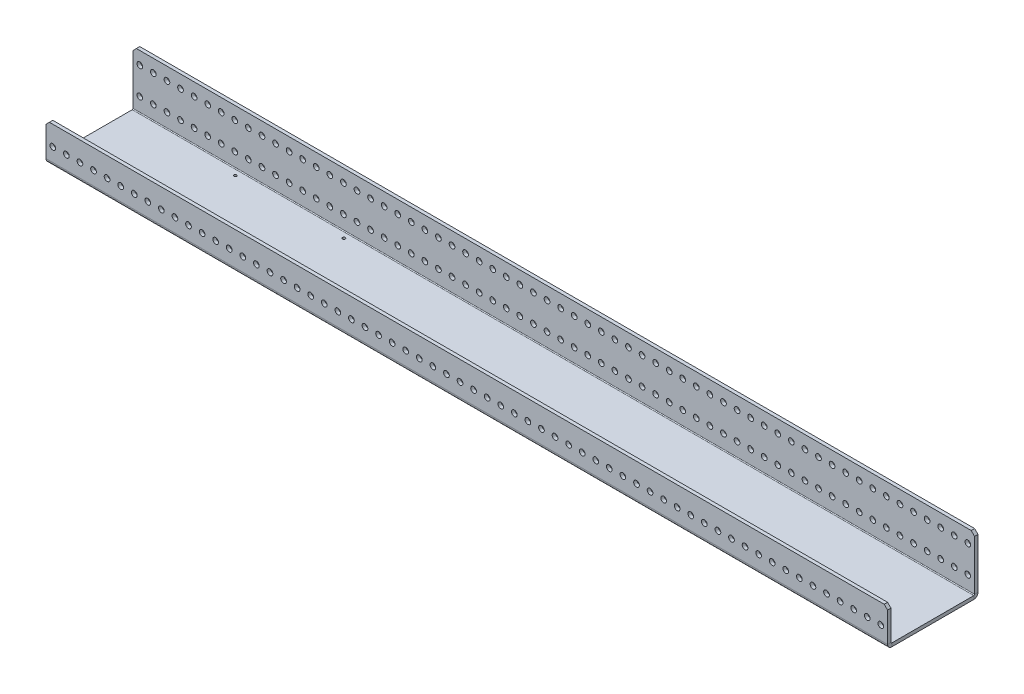
from build123d import *

# Parameters (mm, degrees)
SKETCH1_W                    = 787.4
SKETCH1_H                    = 78.232
BOSS_EXTRUDE1_DEPTH          = 3.175
EDGE_FLANGE1_STRIP_W         = 14.224
EDGE_FLANGE1_STRIP_H         = 3.175
EDGE_FLANGE1_STRIP_CUT_DEPTH = 787.4
EDGE_FLANGE1_DEPTH           = 787.4
EDGE_FLANGE2_STRIP_W         = 14.224
EDGE_FLANGE2_STRIP_H         = 3.175
EDGE_FLANGE2_STRIP_CUT_DEPTH = 787.4
EDGE_FLANGE2_DEPTH           = 787.4
SKETCH9_R                    = 2.667
CUT_EXTRUDE1_DEPTH           = 794.767078776
CHAMFER1_SIZE                = 3.175
LPATTERN1_COUNT              = 62
LPATTERN1_PITCH              = 12.7
SKETCH12_R                   = 1.27
CUT_EXTRUDE4_DEPTH           = 794.225377588
SKETCH14_R                   = 2.667
CUT_EXTRUDE6_DEPTH           = 5.08
LPATTERN4_COUNT              = 62
LPATTERN4_PITCH              = 12.7


# Sheet-metal steps are written as plain solids
with BuildPart() as part:
    # Sketch1 → Boss-Extrude1 (new body)
    with BuildSketch(Plane(origin=(0, 0, 0), x_dir=(1, 0, 0), z_dir=(0, 1, 0))):
        with Locations((393.7, 39.116)):
            Rectangle(SKETCH1_W, SKETCH1_H)
    extrude(amount=BOSS_EXTRUDE1_DEPTH)

    # Edge-Flange1 strip (across the edge) → Edge-Flange1 strip cut (cut)
    with BuildSketch(Plane(origin=(787.4, 3.175, -78.232), x_dir=(0, 0, 1), z_dir=(-1, 0, 0))):
        with Locations((-6.35, -1.5875)):
            Rectangle(EDGE_FLANGE1_STRIP_W, EDGE_FLANGE1_STRIP_H)
    extrude(amount=EDGE_FLANGE1_STRIP_CUT_DEPTH, mode=Mode.SUBTRACT)

    # Edge-Flange1 section (across the edge) → Edge-Flange1 (add)
    with BuildSketch(Plane(origin=(787.4, 3.175, -78.232), x_dir=(0, 0, 1), z_dir=(-1, 0, 0))):
        with BuildLine():
            Line((-3.175, 0.762), (-3.175, 50.8))
            Line((-3.175, 50.8), (0, 50.8))
            Line((0, 50.8), (0, 0.762))
            ThreePointArc((0, 0.762), (0.223184633, 0.223184633), (0.762, 0))
            Line((0.762, 0), (0.762, -3.175))
            ThreePointArc((0.762, -3.175), (-2.021879398, -2.021879398), (-3.175, 0.762))
        make_face()
    extrude(amount=EDGE_FLANGE1_DEPTH)

    # Edge-Flange2 strip (across the edge) → Edge-Flange2 strip cut (cut)
    with BuildSketch(Plane(origin=(0, 3.175, 0), x_dir=(0, 0, -1), z_dir=(1, 0, 0))):
        with Locations((-6.35, -1.5875)):
            Rectangle(EDGE_FLANGE2_STRIP_W, EDGE_FLANGE2_STRIP_H)
    extrude(amount=EDGE_FLANGE2_STRIP_CUT_DEPTH, mode=Mode.SUBTRACT)

    # Edge-Flange2 section (across the edge) → Edge-Flange2 (add)
    with BuildSketch(Plane(origin=(0, 3.175, 0), x_dir=(0, 0, -1), z_dir=(1, 0, 0))):
        with BuildLine():
            Line((-3.175, 0.762), (-3.175, 31.75))
            Line((-3.175, 31.75), (0, 31.75))
            Line((0, 31.75), (0, 0.762))
            ThreePointArc((0, 0.762), (0.223184633, 0.223184633), (0.762, 0))
            Line((0.762, 0), (0.762, -3.175))
            ThreePointArc((0.762, -3.175), (-2.021879398, -2.021879398), (-3.175, 0.762))
        make_face()
    extrude(amount=EDGE_FLANGE2_DEPTH)

    # Sketch9 → Cut-Extrude1 (cut, through all)
    with BuildSketch(Plane.XY.offset(3.175)):
        with Locations((781.05, 16.637)):
            Circle(SKETCH9_R)
    cut_extrude1 = extrude(amount=-CUT_EXTRUDE1_DEPTH, mode=Mode.SUBTRACT)

    # Chamfer1
    chamfer1_edges = [part.edges().sort_by_distance(p)[0] for p in [
        (787.4, 53.975, -79.8195),
        (0, 53.975, -79.8195),
        (0, 34.925, 1.5875),
        (787.4, 34.925, 1.5875),
    ]]
    chamfer(chamfer1_edges, length=CHAMFER1_SIZE)

    # LPattern1: Cut-Extrude1 ×62
    with Locations(*[(-i * LPATTERN1_PITCH, 0, 0) for i in range(1, LPATTERN1_COUNT)]):
        add(cut_extrude1, mode=Mode.SUBTRACT)

    # Sketch12 → Cut-Extrude4 (cut, through all)
    with BuildSketch(Plane(origin=(0, 3.175, 0), x_dir=(1, 0, 0), z_dir=(0, 1, 0))):
        with Locations(Location((101.6, 72.39, 0), (0, 0, 270))):
            Circle(SKETCH12_R)
        with Locations(Location((203.2, 72.39, 0), (0, 0, 270))):
            Circle(SKETCH12_R)
        with Locations(Location((203.2, 5.842, 0), (0, 0, 270))):
            Circle(SKETCH12_R)
        with Locations(Location((101.6, 5.842, 0), (0, 0, 270))):
            Circle(SKETCH12_R)
    extrude(amount=-CUT_EXTRUDE4_DEPTH, mode=Mode.SUBTRACT)

    # Sketch14 → Cut-Extrude6 (cut)
    with BuildSketch(Plane(origin=(0, 0, -81.407), x_dir=(-1, 0, 0), z_dir=(0, 0, -1))):
        with Locations(Location((-781.05, 42.037, 0), (0, 0, 90))):
            Circle(SKETCH14_R)
    cut_extrude6 = extrude(amount=-CUT_EXTRUDE6_DEPTH, mode=Mode.SUBTRACT)

    # LPattern4: Cut-Extrude6 ×62
    with Locations(*[(-i * LPATTERN4_PITCH, 0, 0) for i in range(1, LPATTERN4_COUNT)]):
        add(cut_extrude6, mode=Mode.SUBTRACT)


solid = part.part
